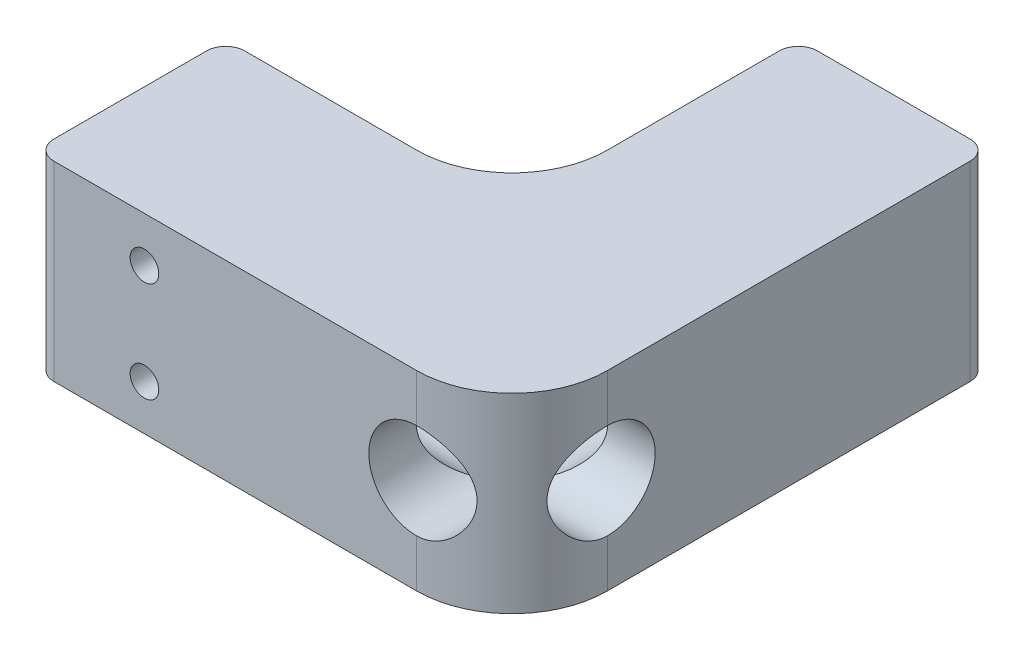
from build123d import *

# Parameters (mm, degrees)
BOSS_EXTRUDE1_DEPTH = 10
SKETCH2_R           = 2.25
CUT_EXTRUDE1_DEPTH  = 65.807406984
SKETCH3_R           = 2.25
CUT_EXTRUDE2_DEPTH  = 60.160797831
SKETCH5_R           = 5
CUT_EXTRUDE3_DEPTH  = 42
SKETCH6_R           = 5
CUT_EXTRUDE4_DEPTH  = 42
CHAMFER1_SIZE       = 2.75
FILLET1_R           = 10
FILLET2_R           = 2
SKETCH8_R           = 1.5
CUT_EXTRUDE5_DEPTH  = 28


# Some blends are built 0.0001 mm under size
with BuildPart() as part:
    # Sketch1 → Boss-Extrude1 (new, symmetric)
    with BuildSketch(Plane(origin=(0, 0, 0), x_dir=(1, 0, 0), z_dir=(0, 1, 0))):
        Polygon((-10, 30), (10, 30), (10, -20), (-40, -20), (-40, 0), (-10, 0), align=None)
    extrude(amount=BOSS_EXTRUDE1_DEPTH, both=True)

    # Sketch2 → Cut-Extrude1 (cut, through all)
    with BuildSketch(Plane(origin=(0, 0, -30), x_dir=(-1, 0, 0), z_dir=(0, 0, -1))):
        Circle(SKETCH2_R)
    extrude(amount=-CUT_EXTRUDE1_DEPTH, mode=Mode.SUBTRACT)

    # Sketch3 → Cut-Extrude2 (cut, through all)
    with BuildSketch(Plane.ZY.offset(40)):
        with Locations((10, 0)):
            Circle(SKETCH3_R)
    extrude(amount=-CUT_EXTRUDE2_DEPTH, mode=Mode.SUBTRACT)

    # Sketch5 → Cut-Extrude3 (cut)
    with BuildSketch(Plane.XY.offset(20)):
        Circle(SKETCH5_R)
    extrude(amount=-CUT_EXTRUDE3_DEPTH, mode=Mode.SUBTRACT)

    # Sketch6 → Cut-Extrude4 (cut)
    with BuildSketch(Plane.ZY.offset(-10)):
        with Locations(Location((10, 0, 0), (0, 0, 180))):
            Circle(SKETCH6_R)
    extrude(amount=CUT_EXTRUDE4_DEPTH, mode=Mode.SUBTRACT)

    # Chamfer1
    chamfer1_edges = [part.edges().sort_by_distance(p)[0] for p in [
        (2.25, 0, -22),
        (-32, 0, 7.75),
    ]]
    chamfer(chamfer1_edges, length=CHAMFER1_SIZE - 0.0001)  # a hair under: the kernel refuses the full size

    # Fillet1
    # the kernel refuses this fillet: 10 mm, written as the material it adds along each edge
    with BuildSketch(Plane(origin=(-10, -10, 0), x_dir=(0, 0, -1), z_dir=(0, 1, 0))) as fillet1_piece_1:
        with BuildLine():
            CenterArc((FILLET1_R, FILLET1_R), FILLET1_R, 180, 90)
            Line((0, FILLET1_R), (0, 0))
            Line((0, 0), (FILLET1_R, 0))
        make_face()
    extrude(amount=20)
    # the kernel refuses this fillet: 10 mm, written as the material it takes off along each edge
    with BuildSketch(Plane(origin=(10, 35, 20), x_dir=(0, 0, -1), z_dir=(0, -1, 0))) as fillet1_2_piece_1:
        with BuildLine():
            CenterArc((FILLET1_R, -FILLET1_R), FILLET1_R, 90, 90)
            Line((0, -FILLET1_R), (0, 0))
            Line((0, 0), (FILLET1_R, 0))
        make_face()
    extrude(amount=70, mode=Mode.SUBTRACT)

    # Fillet2
    fillet2_edges = [part.edges().sort_by_distance(p)[0] for p in [
        (-10, 0, -30),
        (10, 0, -30),
        (-40, 0, 20),
        (-40, 0, 0),
    ]]
    fillet(fillet2_edges, radius=FILLET2_R)

    # Sketch8 → Cut-Extrude5 (cut)
    with BuildSketch(Plane.XY.offset(20)):
        with Locations((-28.509155223, 5.263420724)):
            Circle(SKETCH8_R)
        with Locations((-28.509155223, -5.263420724)):
            Circle(SKETCH8_R)
    extrude(amount=-CUT_EXTRUDE5_DEPTH, mode=Mode.SUBTRACT)


solid = part.part
